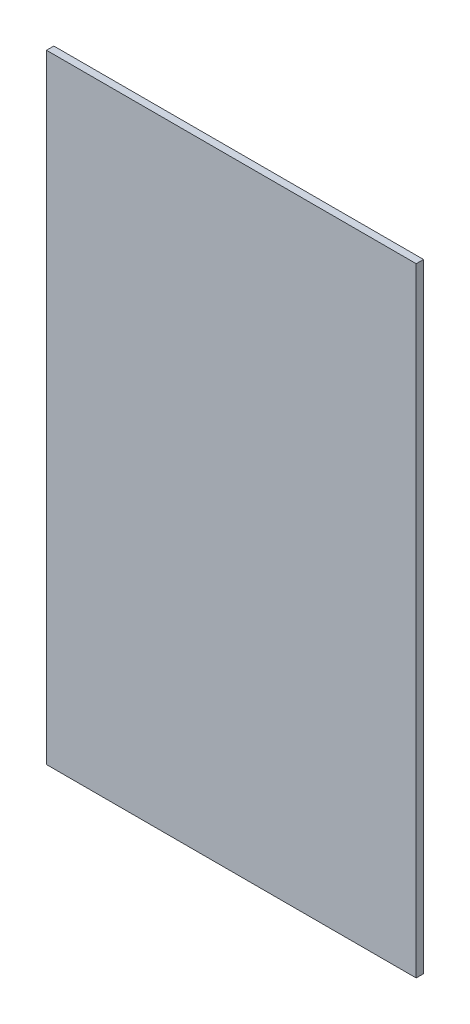
from build123d import *

# Parameters (mm, degrees)
SKETCH1_W           = 302.4
SKETCH1_H           = 506
BOSS_EXTRUDE1_DEPTH = 6


with BuildPart() as part:
    # Sketch1 → Boss-Extrude1 (new body)
    with BuildSketch(Plane.XY):
        with Locations((151.2, 253)):
            Rectangle(SKETCH1_W, SKETCH1_H)
    extrude(amount=BOSS_EXTRUDE1_DEPTH)


solid = part.part
